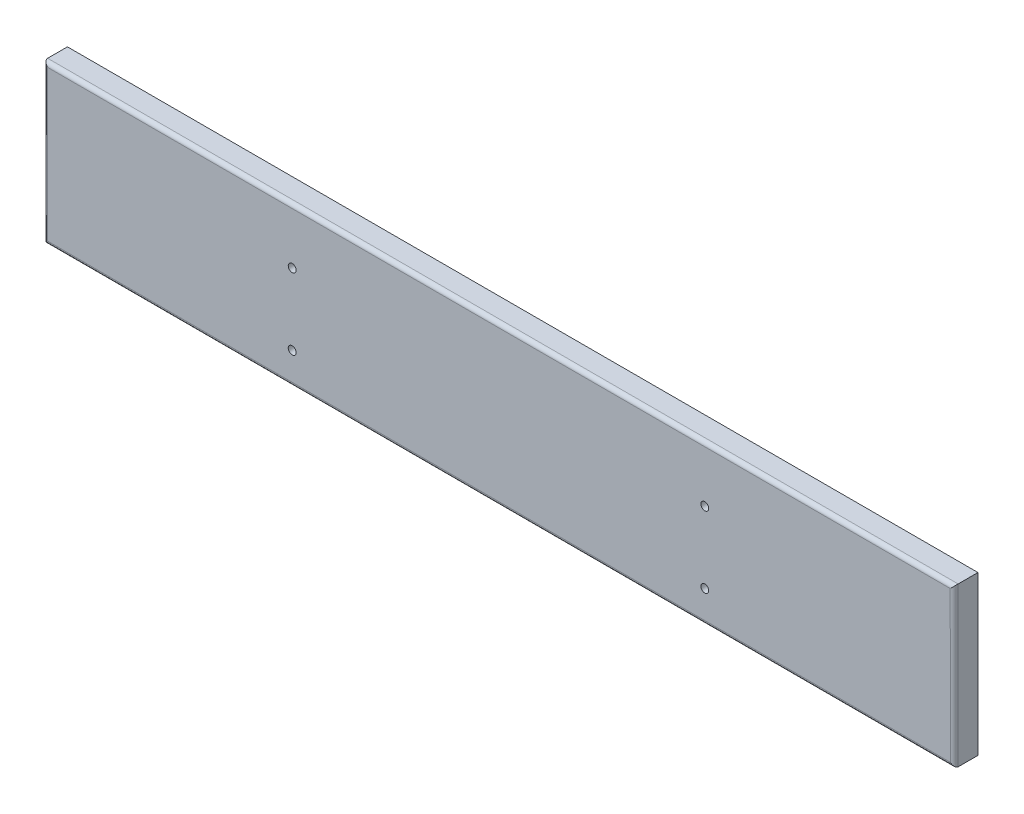
from build123d import *

# Parameters (mm, degrees)
BOSS_EXTRUDE1_DEPTH         = 19.05
F_1_4_0_25_DIAMETER_HOLE1_D = 6.35
FILLET1_R                   = 3.175


with BuildPart() as part:
    # Sketch1 → Boss-Extrude1 (new body)
    with BuildSketch(Plane.XY.offset(-348.182458287)):
        Polygon((378.797753528, 164.483362877), (-351.452246472, 164.483362877), (-351.452246472, 37.483362877), (378.838596905, 37.483362877), align=None)
    extrude(amount=BOSS_EXTRUDE1_DEPTH)

    # 1/4 (0.25) Diameter Hole1 (through all)
    with Locations(Plane.XY.offset(-329.132458287)):
        with Locations((-152.13904646, 120.033362877), (-152.13904646, 62.883362877), (178.772753528, 62.883362877), (178.772753528, 120.033362877)):
            Hole(F_1_4_0_25_DIAMETER_HOLE1_D / 2)

    # Fillet1
    fillet1_edges = [part.edges().sort_by_distance(p)[0] for p in [
        (-351.452246472, 100.983362877, -329.132458287),
        (13.693175216, 37.483362877, -329.132458287),
        (378.818175216, 100.983362877, -329.132458287),
        (13.672753528, 164.483362877, -329.132458287),
    ]]
    fillet(fillet1_edges, radius=FILLET1_R)


solid = part.part
